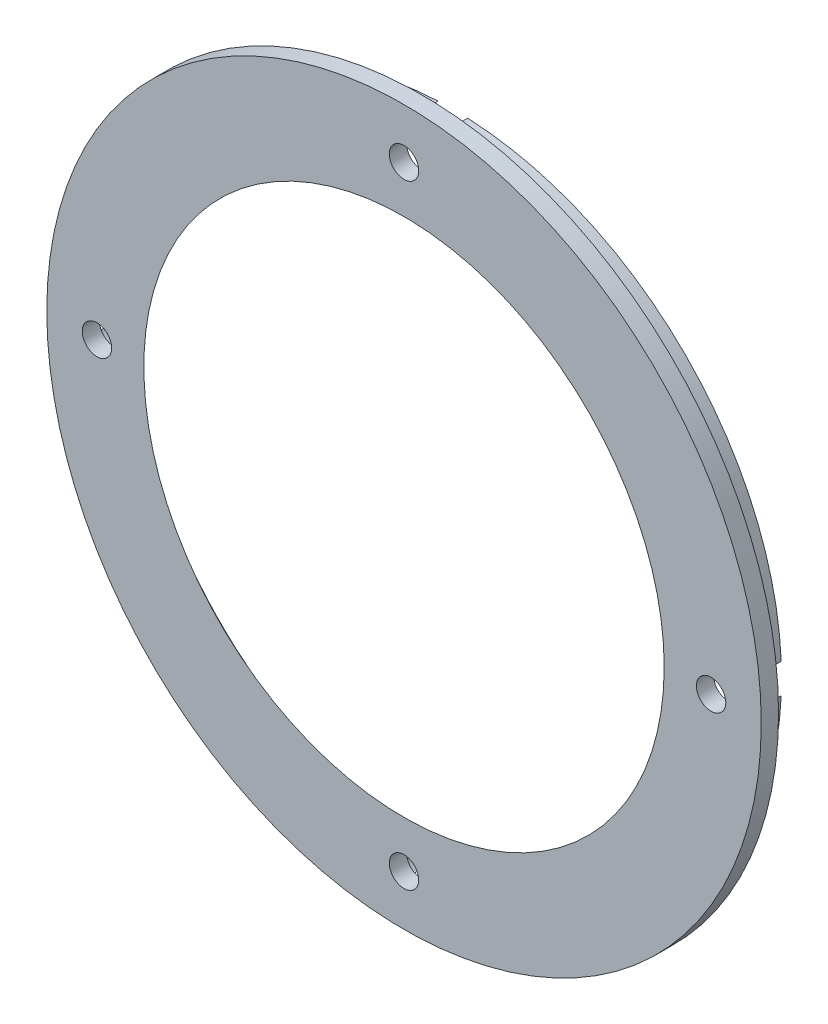
from build123d import *
from build123d.topology import SkipClean

# Parameters (mm, degrees)
SKETCH3_R           = 3
CUT_EXTRUDE1_DEPTH  = 75.457245764
SKETCH4_R           = 41.3
CUT_EXTRUDE2_DEPTH  = 10
SKETCH4_3_R         = 41.3
BOSS_EXTRUDE1_DEPTH = 2
SKETCH5_R           = 3
SKETCH5_R_2         = 1.7
BOSS_EXTRUDE2_DEPTH = 2


with BuildPart() as part:
    # Sketch2 → Revolve1 (revolve)
    with BuildSketch(Plane(origin=(0, 0, 0), x_dir=(1, 0, 0), z_dir=(0, 1, 0))):
        Polygon((-21.165551628, 4), (-21.165551628, -4), (-9.945763659, -4), align=None)
    revolve(axis=Axis((20.134448372, 0, 4), (0, 0, -1)))

    # Sketch3 → Cut-Extrude1 (cut, through all)
    with BuildSketch(Plane.XY.offset(4)):
        with Locations((20.134448372, 35.5)):
            Circle(SKETCH3_R)
        with Locations((-15.365551628, 0)):
            Circle(SKETCH3_R)
        with Locations((55.634448372, 0)):
            Circle(SKETCH3_R)
        with Locations((20.134448372, -35.5)):
            Circle(SKETCH3_R)
    extrude(amount=-CUT_EXTRUDE1_DEPTH, mode=Mode.SUBTRACT)

    # Sketch4 → Cut-Extrude2 (cut)
    with BuildSketch(Plane.XY.offset(4)):
        with Locations((20.134448372, 0)):
            Circle(SKETCH4_R)
        with BuildLine():
            ThreePointArc((21.849721462, 37.961267606), (47.004506057, 26.870057685), (58.095715978, 1.71527309))
            ThreePointArc((58.095715978, 1.71527309), (58.49659816, 0.898943041), (58.634448372, 0))
            ThreePointArc((58.634448372, 0), (58.49659816, -0.898943041), (58.095715978, -1.71527309))
            ThreePointArc((58.095715978, -1.71527309), (47.004506057, -26.870057685), (21.849721462, -37.961267606))
            ThreePointArc((21.849721462, -37.961267606), (20.134448372, -38.5), (18.419175282, -37.961267606))
            ThreePointArc((18.419175282, -37.961267606), (-6.735609313, -26.870057685), (-17.826819233, -1.71527309))
            ThreePointArc((-17.826819233, -1.71527309), (-18.365551628, 0), (-17.826819233, 1.71527309))
            ThreePointArc((-17.826819233, 1.71527309), (-6.735609313, 26.870057685), (18.419175282, 37.961267606))
            ThreePointArc((18.419175282, 37.961267606), (20.134448372, 38.5), (21.849721462, 37.961267606))
        make_face(mode=Mode.SUBTRACT)
    extrude(amount=-CUT_EXTRUDE2_DEPTH, mode=Mode.SUBTRACT)

    # Sketch4<3> → Boss-Extrude1 (add)
    with SkipClean():  # the faces are left unmerged after this step: merging them gives an invalid solid
        with BuildSketch(Plane.XY.offset(4)):
            with Locations((20.134448372, 0)):
                Circle(SKETCH4_3_R)
            with BuildLine():
                ThreePointArc((21.849721462, 37.961267606), (47.004506057, 26.870057685), (58.095715978, 1.71527309))
                ThreePointArc((58.095715978, 1.71527309), (58.49659816, 0.898943041), (58.634448372, 0))
                ThreePointArc((58.634448372, 0), (58.49659816, -0.898943041), (58.095715978, -1.71527309))
                ThreePointArc((58.095715978, -1.71527309), (47.004506057, -26.870057685), (21.849721462, -37.961267606))
                ThreePointArc((21.849721462, -37.961267606), (20.134448372, -38.5), (18.419175282, -37.961267606))
                ThreePointArc((18.419175282, -37.961267606), (-6.735609313, -26.870057685), (-17.826819233, -1.71527309))
                ThreePointArc((-17.826819233, -1.71527309), (-18.365551628, 0), (-17.826819233, 1.71527309))
                ThreePointArc((-17.826819233, 1.71527309), (-6.735609313, 26.870057685), (18.419175282, 37.961267606))
                ThreePointArc((18.419175282, 37.961267606), (20.134448372, 38.5), (21.849721462, 37.961267606))
            make_face(mode=Mode.SUBTRACT)
        extrude(amount=-BOSS_EXTRUDE1_DEPTH)

    # Sketch5 → Boss-Extrude2 (add)
    # profile 1 of 4: a face of its own
    with BuildSketch(Plane.XY.offset(4)):
        with Locations((20.134448372, -35.5)):
            Circle(SKETCH5_R)
        with Locations((20.134448372, -35.5)):
            Circle(SKETCH5_R_2, mode=Mode.SUBTRACT)
    # profile 2 of 4: a face of its own
    with BuildSketch(Plane.XY.offset(4)):
        with Locations((-15.365551628, 0)):
            Circle(SKETCH5_R)
        with Locations((-15.365551628, 0)):
            Circle(SKETCH5_R_2, mode=Mode.SUBTRACT)
    # profile 3 of 4: a face of its own
    with BuildSketch(Plane.XY.offset(4)):
        with Locations((20.134448372, 35.5)):
            Circle(SKETCH5_R)
        with Locations((20.134448372, 35.5)):
            Circle(SKETCH5_R_2, mode=Mode.SUBTRACT)
    # profile 4 of 4: a face of its own
    with BuildSketch(Plane.XY.offset(4)):
        with Locations((55.634448372, 0)):
            Circle(SKETCH5_R)
        with Locations((55.634448372, 0)):
            Circle(SKETCH5_R_2, mode=Mode.SUBTRACT)
    extrude(amount=-BOSS_EXTRUDE2_DEPTH)


solid = part.part
